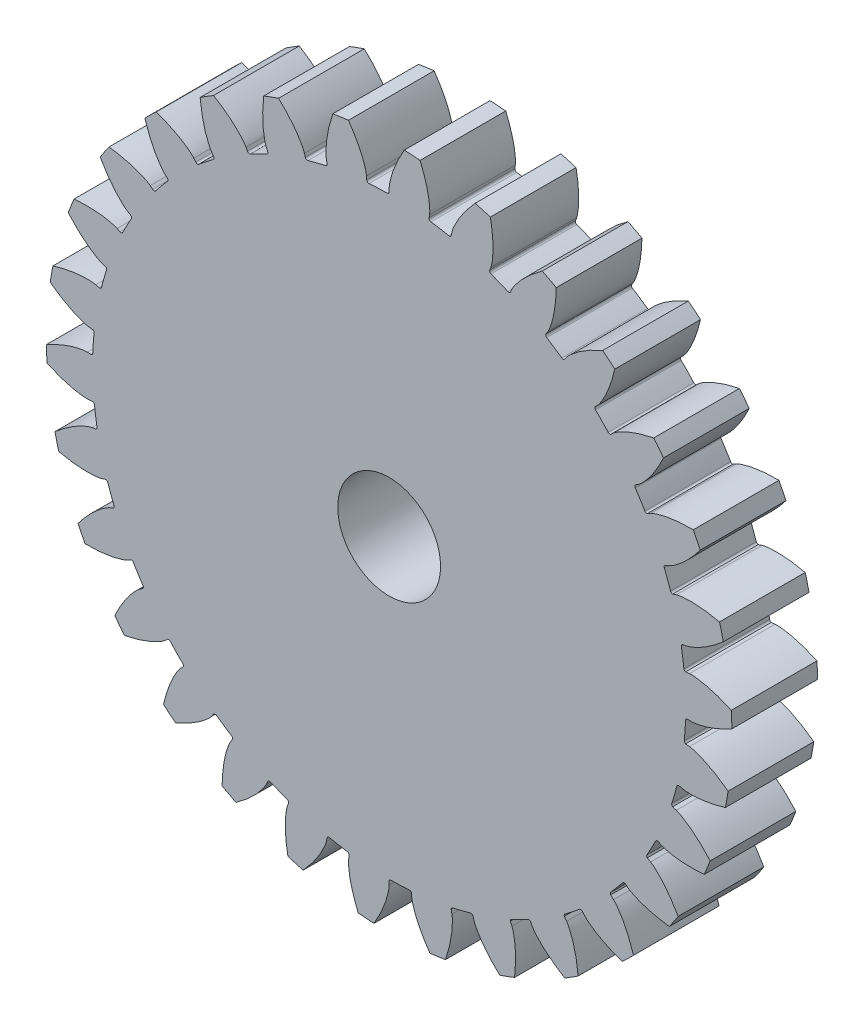
from build123d import *

# Parameters (mm, degrees)
CROQUIS2_R              = 3
SALIENTE_EXTRUIR1_DEPTH = 5
MATRIZC6_COUNT          = 30


with BuildPart() as part:
    # Croquis2 → Saliente-Extruir1 (new body)
    with BuildSketch(Plane.XY):
        with BuildLine():
            Line((0, 17.391052591), (0, 17.61923664))
            add(Edge.make_bspline(
                [(0, 17.61923664), (0.002968389, 17.708678911), (0.030865619, 17.908423079), (0.110728878, 18.25740541), (0.25502818, 18.704841344), (0.488882061, 19.262091692), (0.716792081, 19.695707807), (0.862564894, 19.944247124), (0.88412324, 19.980448596)],
                knots=[0, 0, 0, 0, 0.049384323, 0.111112812, 0.197532517, 0.308643471, 0.44444569, 0.467706461, 0.467706461, 0.467706461, 0.467706461], degree=3))
            ThreePointArc((0.88412324, 19.980448596), (1.344285858, 19.954771247), (1.80373463, 19.918497468))
            add(Edge.make_bspline(
                [(2.363172784, 17.460037633), (2.372227624, 17.549069881), (2.371373063, 17.75075096), (2.33903852, 18.10729168), (2.256055196, 18.57003888), (2.099055278, 19.153619735), (1.931363125, 19.613886239), (1.820242679, 19.879731591), (1.80373463, 19.918497468)],
                knots=[0, 0, 0, 0, 0.049384323, 0.111112812, 0.197532517, 0.308643471, 0.44444569, 0.467706461, 0.467706461, 0.467706461, 0.467706461], degree=3))
            Line((2.363172784, 17.460037633), (2.332489759, 17.275351458))
            ThreePointArc((2.332489759, 17.275351458), (2.354972763, 17.180980546), (2.438186458, 17.131112365))
            ThreePointArc((2.438186458, 17.131112365), (-1.163059321, -17.264618649), (-0.118452851, 17.303344561))
            ThreePointArc((-0.118452851, 17.303344561), (-0.044924166, 17.327882859), (0, 17.391052591))
        make_face()
        Circle(CROQUIS2_R, mode=Mode.SUBTRACT)
    saliente_extruir1 = extrude(amount=SALIENTE_EXTRUIR1_DEPTH)

    # MatrizC6: Saliente-Extruir1 ×30 about axis
    matrizc6_axis = Axis((0, 0, 5), (0, 0, -1))
    for i in range(1, MATRIZC6_COUNT):
        add(saliente_extruir1.rotate(matrizc6_axis, i * 360 / MATRIZC6_COUNT))


solid = part.part
